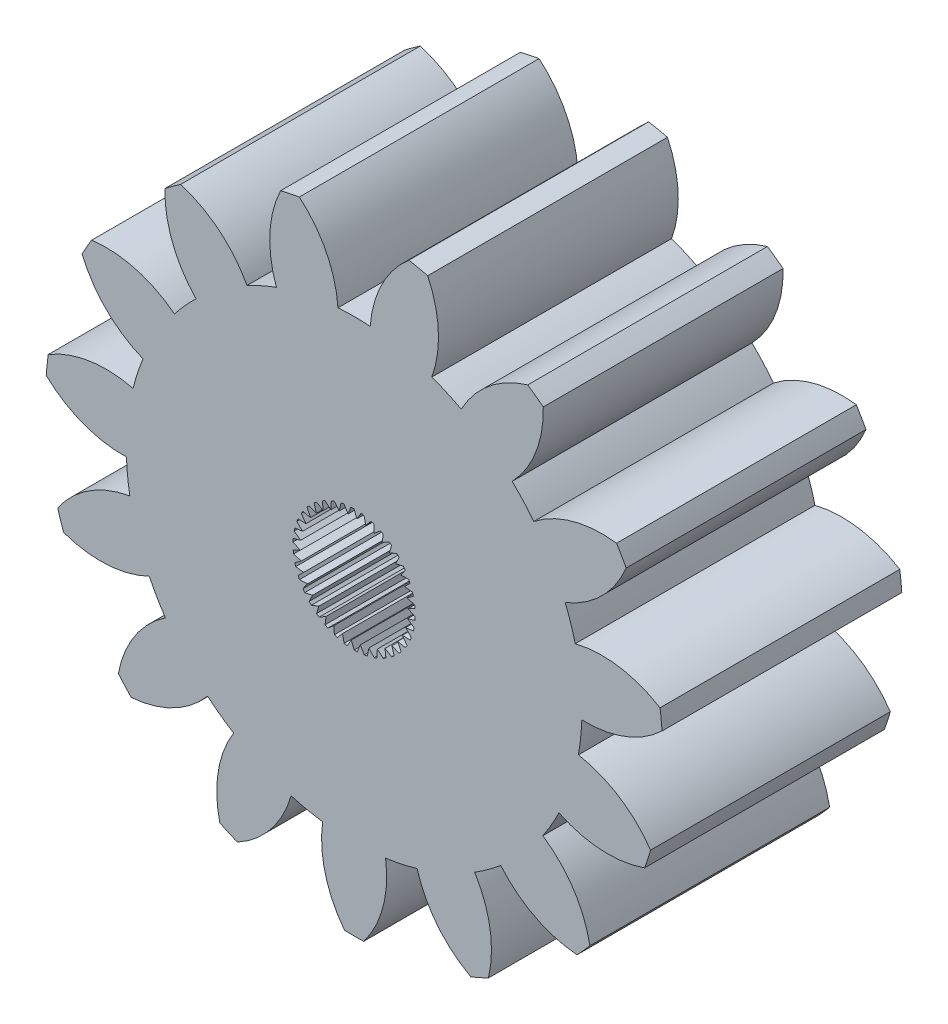
from build123d import *

# Parameters (mm, degrees)
SKETCH1_R           = 70.548036847
BOSS_EXTRUDE1_DEPTH = 10
SKETCH3_R           = 367.512428381
SKETCH3_R_2         = 2.249999999
CUT_EXTRUDE2_DEPTH  = 269.283414963
CUT_EXTRUDE4_DEPTH  = 10


with BuildPart() as part:
    # Sketch1 → Boss-Extrude1 (new body)
    with BuildSketch(Plane.XY):
        Circle(SKETCH1_R)
    extrude(amount=BOSS_EXTRUDE1_DEPTH)

    # Sketch3 → Cut-Extrude2 (cut, through all)
    # profile 1 of 2: a face of its own
    with BuildSketch(Plane(origin=(55.025604462, -141.718387499, 105.594585314), x_dir=(1, 0, 0), z_dir=(0, 0, 1))):
        with Locations((-43.461576529, 148.105383059)):
            Circle(SKETCH3_R)
        with BuildLine():
            ThreePointArc((-38.992966759, 156.489924055), (-37.834855129, 157.900828095), (-36.221197708, 158.75404699))
            ThreePointArc((-36.221197708, 158.75404699), (-35.892665836, 158.523094895), (-35.571495409, 158.28201064))
            ThreePointArc((-35.571495409, 158.28201064), (-35.884307233, 156.483672095), (-36.868280539, 154.946249158))
            ThreePointArc((-36.868280539, 154.946249158), (-36.400957543, 154.46279295), (-35.968998313, 153.947495063))
            ThreePointArc((-35.968998313, 153.947495063), (-34.337144321, 154.765373604), (-32.515959525, 154.888494247))
            ThreePointArc((-32.515959525, 154.888494247), (-32.309767405, 154.543883059), (-32.114421422, 154.193009851))
            ThreePointArc((-32.114421422, 154.193009851), (-33.131639425, 152.677377874), (-34.655870014, 151.673090132))
            ThreePointArc((-34.655870014, 151.673090132), (-34.425588568, 151.041353522), (-34.240564709, 150.394911831))
            ThreePointArc((-34.240564709, 150.394911831), (-32.417130735, 150.478346243), (-30.70331796, 149.850079957))
            ThreePointArc((-30.70331796, 149.850079957), (-30.655118083, 149.45139608), (-30.619373638, 149.051403086))
            ThreePointArc((-30.619373638, 149.051403086), (-32.165111587, 148.080544213), (-33.966046142, 147.783042142))
            ThreePointArc((-33.966046142, 147.783042142), (-34.012624001, 147.112258129), (-34.106527818, 146.446448275))
            ThreePointArc((-34.106527818, 146.446448275), (-32.406802162, 145.78101199), (-31.096695206, 144.509991723))
            ThreePointArc((-31.096695206, 144.509991723), (-31.214821769, 144.126171222), (-31.344859402, 143.746220863))
            ThreePointArc((-31.344859402, 143.746220863), (-33.151845162, 143.488005415), (-34.918085739, 143.948729825))
            ThreePointArc((-34.918085739, 143.948729825), (-35.233469168, 143.354883059), (-35.590063838, 142.784829614))
            ThreePointArc((-35.590063838, 142.784829614), (-34.307944507, 141.485582611), (-33.628072765, 139.791579314))
            ThreePointArc((-33.628072765, 139.791579314), (-33.892100612, 139.488988241), (-34.165435634, 139.194777386))
            ThreePointArc((-34.165435634, 139.194777386), (-35.921224952, 139.693853159), (-37.347372508, 140.833140613))
            ThreePointArc((-37.347372508, 140.833140613), (-37.877028847, 140.418912595), (-38.434655913, 140.04318298))
            ThreePointArc((-38.434655913, 140.04318298), (-37.791832987, 138.334776868), (-37.859752459, 136.510699101))
            ThreePointArc((-37.859752459, 136.510699101), (-38.224028776, 136.341658201), (-38.59339908, 136.184058581))
            ThreePointArc((-38.59339908, 136.184058581), (-39.994400032, 137.354130839), (-40.833860699, 138.974988187))
            ThreePointArc((-40.833860699, 138.974988187), (-41.486207555, 138.812002704), (-42.14844823, 138.695563981))
            ThreePointArc((-42.14844823, 138.695563981), (-42.256071633, 136.873397699), (-43.060038426, 135.234645079))
            ThreePointArc((-43.060038426, 135.234645079), (-43.461576529, 135.228383059), (-43.863114633, 135.234645079))
            ThreePointArc((-43.863114633, 135.234645079), (-44.667081426, 136.873397699), (-44.774704828, 138.695563981))
            ThreePointArc((-44.774704828, 138.695563981), (-45.436945504, 138.812002704), (-46.08929236, 138.974988187))
            ThreePointArc((-46.08929236, 138.974988187), (-46.928753027, 137.354130839), (-48.329753979, 136.184058581))
            ThreePointArc((-48.329753979, 136.184058581), (-48.699124282, 136.341658201), (-49.0634006, 136.510699101))
            ThreePointArc((-49.0634006, 136.510699101), (-49.131320072, 138.334776868), (-48.488497146, 140.04318298))
            ThreePointArc((-48.488497146, 140.04318298), (-49.046124211, 140.418912595), (-49.575780551, 140.833140613))
            ThreePointArc((-49.575780551, 140.833140613), (-51.001928107, 139.693853159), (-52.757717425, 139.194777386))
            ThreePointArc((-52.757717425, 139.194777386), (-53.031052447, 139.488988241), (-53.295080294, 139.791579314))
            ThreePointArc((-53.295080294, 139.791579314), (-52.615208552, 141.485582611), (-51.33308922, 142.784829614))
            ThreePointArc((-51.33308922, 142.784829614), (-51.689683891, 143.354883059), (-52.00506732, 143.948729825))
            ThreePointArc((-52.00506732, 143.948729825), (-53.771307897, 143.488005415), (-55.578293657, 143.746220863))
            ThreePointArc((-55.578293657, 143.746220863), (-55.70833129, 144.126171222), (-55.826457853, 144.509991723))
            ThreePointArc((-55.826457853, 144.509991723), (-54.516350896, 145.78101199), (-52.81662524, 146.446448275))
            ThreePointArc((-52.81662524, 146.446448275), (-52.910529057, 147.112258129), (-52.957106917, 147.783042142))
            ThreePointArc((-52.957106917, 147.783042142), (-54.758041472, 148.080544213), (-56.303779421, 149.051403086))
            ThreePointArc((-56.303779421, 149.051403086), (-56.268034976, 149.45139608), (-56.219835099, 149.850079957))
            ThreePointArc((-56.219835099, 149.850079957), (-54.506022324, 150.478346243), (-52.68258835, 150.394911831))
            ThreePointArc((-52.68258835, 150.394911831), (-52.497564491, 151.041353522), (-52.267283045, 151.673090132))
            ThreePointArc((-52.267283045, 151.673090132), (-53.791513634, 152.677377874), (-54.808731637, 154.193009851))
            ThreePointArc((-54.808731637, 154.193009851), (-54.613385654, 154.543883059), (-54.407193534, 154.888494247))
            ThreePointArc((-54.407193534, 154.888494247), (-52.586008737, 154.765373604), (-50.954154746, 153.947495063))
            ThreePointArc((-50.954154746, 153.947495063), (-50.522195516, 154.46279295), (-50.054872519, 154.946249158))
            ThreePointArc((-50.054872519, 154.946249158), (-51.038845826, 156.483672095), (-51.35165765, 158.28201064))
            ThreePointArc((-51.35165765, 158.28201064), (-51.030487223, 158.523094895), (-50.701955351, 158.75404699))
            ThreePointArc((-50.701955351, 158.75404699), (-49.088297929, 157.900828095), (-47.9301863, 156.489924055))
            ThreePointArc((-47.9301863, 156.489924055), (-47.325981375, 156.784978452), (-46.702421219, 157.036560288))
            ThreePointArc((-46.702421219, 157.036560288), (-46.975999319, 158.841284028), (-46.530316957, 160.611380068))
            ThreePointArc((-46.530316957, 160.611380068), (-46.138855372, 160.700989714), (-45.744789892, 160.778349))
            ThreePointArc((-45.744789892, 160.778349), (-44.617675874, 159.342561151), (-44.133554629, 157.582589738))
            ThreePointArc((-44.133554629, 157.582589738), (-43.461576529, 157.606383059), (-42.78959843, 157.582589738))
            ThreePointArc((-42.78959843, 157.582589738), (-42.305477184, 159.342561151), (-41.178363166, 160.778349))
            ThreePointArc((-41.178363166, 160.778349), (-40.784297687, 160.700989714), (-40.392836101, 160.611380068))
            ThreePointArc((-40.392836101, 160.611380068), (-39.94715374, 158.841284028), (-40.22073184, 157.036560288))
            ThreePointArc((-40.22073184, 157.036560288), (-39.597171684, 156.784978452), (-38.992966759, 156.489924055))
        make_face(mode=Mode.SUBTRACT)
    # profile 2 of 2: a face of its own
    with BuildSketch(Plane(origin=(55.025604462, -141.718387499, 105.594585314), x_dir=(1, 0, 0), z_dir=(0, 0, 1))):
        with Locations((-43.461576529, 148.105383059)):
            Circle(SKETCH3_R_2)
    extrude(amount=-CUT_EXTRUDE2_DEPTH, mode=Mode.SUBTRACT)

    # Sketch4 → Cut-Extrude4 (cut)
    with BuildSketch(Plane.XY.offset(10)):
        with BuildLine():
            Line((9.127956815, 5.633299661), (9.459541206, 5.590983238))
            Line((9.459541206, 5.590983238), (9.229545605, 5.360987637))
            ThreePointArc((9.229545605, 5.360987637), (9.256631551, 5.301444117), (9.285235917, 5.242614963))
            Line((9.285235918, 5.242614963), (9.619262985, 5.255452678))
            Line((9.619262985, 5.255452678), (9.430260255, 4.990737885))
            ThreePointArc((9.430260254, 4.990737885), (9.466777325, 4.936464662), (9.504674526, 4.883145985))
            Line((9.504674527, 4.883145986), (9.832032881, 4.950787659))
            Line((9.832032881, 4.950787659), (9.689178525, 4.658574404))
            ThreePointArc((9.689178524, 4.658574403), (9.734130628, 4.611051908), (9.780286927, 4.564698102))
            Line((9.780286928, 4.564698104), (10.092047088, 4.685298647))
            Line((10.092047088, 4.685298647), (9.9992378, 4.373557746))
            ThreePointArc((9.999237799, 4.373557744), (10.051398761, 4.334082267), (10.104555133, 4.295957744))
            Line((10.104555134, 4.295957747), (10.392213095, 4.466227491))
            Line((10.392213095, 4.466227491), (10.351980471, 4.143462423))
            ThreePointArc((10.35198047, 4.143462421), (10.409927473, 4.11311075), (10.468633953, 4.084255447))
            Line((10.468633954, 4.08425545), (10.724343156, 4.299549881))
            Line((10.724343156, 4.299549881), (10.737784636, 3.974564836))
            ThreePointArc((10.737784635, 3.974564833), (10.799937039, 3.954164883), (10.862592265, 3.935365897))
            Line((10.862592266, 3.935365901), (11.079377628, 4.189812348))
            Line((11.079377628, 4.189812348), (11.146126565, 3.87147207))
            ThreePointArc((11.146126565, 3.871472067), (11.210789012, 3.861580294), (11.275683913, 3.853350414))
            Line((11.275683914, 3.853350418), (11.447632098, 4.140008245))
            Line((11.447632098, 4.140008245), (11.565867754, 3.836996228))
            ThreePointArc((11.565867754, 3.836996224), (11.631276422, 3.837882452), (11.696640835, 3.840446166))
            Line((11.696640835, 3.84044617), (11.819061542, 4.151496099))
            Line((11.819061542, 4.151496099), (11.985558757, 3.87207772))
            ThreePointArc((11.985558758, 3.872077716), (12.049929468, 3.88371777), (12.113980423, 3.897005147))
            Line((12.113980422, 3.897005151), (12.183534335, 4.223962551))
            Line((12.183534335, 4.223962551), (12.393751498, 3.975759615))
            ThreePointArc((12.393751499, 3.975759611), (12.455328387, 3.99783598), (12.51631874, 4.021484576))
            Line((12.516318738, 4.02148458), (12.531108607, 4.355430905))
            Line((12.531108607, 4.355430905), (12.779311543, 4.145213741))
            ThreePointArc((12.779311545, 4.145213738), (12.836414954, 4.177124237), (12.892681046, 4.210488978))
            Line((12.892681044, 4.210488982), (12.85230344, 4.542315046))
            Line((12.85230344, 4.542315046), (13.131721819, 4.375817831))
            ThreePointArc((13.131721822, 4.375817829), (13.182794118, 4.416692022), (13.232801159, 4.458862806))
            Line((13.232801157, 4.458862809), (13.138357475, 4.779517264))
            Line((13.138357475, 4.779517264), (13.441369493, 4.661281607))
            ThreePointArc((13.441369495, 4.661281605), (13.485017562, 4.710004552), (13.527401488, 4.75983107))
            Line((13.527401486, 4.759831072), (13.381467904, 5.060567299))
            Line((13.381467904, 5.060567299), (13.699808183, 4.993818362))
            ThreePointArc((13.699808185, 4.99381836), (13.734841415, 5.049061025), (13.768446105, 5.105184139))
            Line((13.768446102, 5.105184141), (13.575003309, 5.377798839))
            Line((13.575003309, 5.377798839), (13.899988354, 5.364357358))
            ThreePointArc((13.899988357, 5.364357357), (13.925451135, 5.424612864), (13.94935994, 5.485501683))
            Line((13.949359937, 5.485501684), (13.713684547, 5.722558636))
            Line((13.713684547, 5.722558636), (14.036449615, 5.762791259))
            ThreePointArc((14.036449617, 5.762791259), (14.051647386, 5.826415995), (14.065208136, 5.890409629))
            Line((14.065208134, 5.89040963), (13.793728757, 6.085442539))
            Line((13.793728757, 6.085442539), (14.105469658, 6.178251827))
            ThreePointArc((14.105469659, 6.178251827), (14.109987863, 6.243510274), (14.112830656, 6.308863145))
            Line((14.112830654, 6.308863145), (13.81295254, 6.456552023))
            Line((13.81295254, 6.456552023), (14.105165795, 6.599406379))
            ThreePointArc((14.105165796, 6.599406379), (14.09888119, 6.664518459), (14.090928481, 6.72944791))
            Line((14.090928481, 6.729447909), (13.770831523, 6.825764189))
            Line((13.770831523, 6.825764189), (14.035546316, 7.014766918))
            ThreePointArc((14.035546315, 7.014766918), (14.018630327, 7.077956541), (14.000099047, 7.140691466))
            Line((14.000099047, 7.140691466), (13.668514656, 7.183007889))
            Line((13.668514656, 7.183007889), (13.898510257, 7.413003491))
            ThreePointArc((13.898510257, 7.41300349), (13.87142431, 7.47254701), (13.842819943, 7.531376164))
            Line((13.842819944, 7.531376164), (13.508792877, 7.518538449))
            Line((13.508792877, 7.518538449), (13.697795607, 7.783253242))
            ThreePointArc((13.697795606, 7.783253241), (13.661278535, 7.837526464), (13.623381334, 7.890845141))
            Line((13.623381335, 7.890845142), (13.296022981, 7.823203468))
            Line((13.296022981, 7.823203468), (13.438877336, 8.115416723))
            ThreePointArc((13.438877335, 8.115416722), (13.393925231, 8.162939217), (13.347768932, 8.209293022))
            Line((13.347768934, 8.209293023), (13.036008774, 8.08869248))
            Line((13.036008774, 8.08869248), (13.128818062, 8.400433381))
            ThreePointArc((13.12881806, 8.400433379), (13.076657098, 8.439908856), (13.023500726, 8.478033379))
            Line((13.023500728, 8.478033381), (12.735842767, 8.307763636))
            Line((12.735842767, 8.307763636), (12.776075391, 8.630528704))
            ThreePointArc((12.77607539, 8.630528701), (12.718128386, 8.660880372), (12.659421907, 8.689735675))
            Line((12.659421908, 8.689735677), (12.403712706, 8.474441246))
            Line((12.403712706, 8.474441246), (12.390271226, 8.799426292))
            ThreePointArc((12.390271224, 8.799426288), (12.328118821, 8.819826238), (12.265463595, 8.838625223))
            Line((12.265463596, 8.838625227), (12.048678234, 8.584178779))
            Line((12.048678234, 8.584178779), (11.981929297, 8.902519057))
            ThreePointArc((11.981929296, 8.902519053), (11.917266849, 8.912410825), (11.852371948, 8.920640705))
            Line((11.852371948, 8.920640709), (11.680423764, 8.633982882))
            Line((11.680423764, 8.633982882), (11.562188108, 8.9369949))
            ThreePointArc((11.562188108, 8.936994895), (11.496779441, 8.936108667), (11.431415027, 8.933544953))
            Line((11.431415027, 8.933544957), (11.30899432, 8.622495028))
            Line((11.30899432, 8.622495028), (11.142497105, 8.901913408))
            ThreePointArc((11.142497106, 8.901913403), (11.078126396, 8.890273349), (11.014075441, 8.876985972))
            Line((11.01407544, 8.876985976), (10.944521527, 8.550028576))
            Line((10.944521527, 8.550028576), (10.734304364, 8.798231512))
            ThreePointArc((10.734304365, 8.798231508), (10.672727478, 8.776155139), (10.611737125, 8.752506544))
            Line((10.611737124, 8.752506547), (10.596947255, 8.418560223))
            Line((10.596947255, 8.418560223), (10.348744319, 8.628777386))
            ThreePointArc((10.348744321, 8.628777382), (10.291640913, 8.596866884), (10.23537482, 8.563502142))
            Line((10.235374818, 8.563502146), (10.275752422, 8.231676081))
            Line((10.275752422, 8.231676081), (9.996334043, 8.398173296))
            ThreePointArc((9.996334045, 8.398173292), (9.945261749, 8.357299099), (9.895254708, 8.315128315))
            Line((9.895254705, 8.315128318), (9.989698387, 7.994473863))
            Line((9.989698387, 7.994473863), (9.686686369, 8.11270952))
            ThreePointArc((9.686686372, 8.112709517), (9.643038306, 8.063986571), (9.600654379, 8.014160053))
            Line((9.600654376, 8.014160055), (9.746587958, 7.713423828))
            Line((9.746587958, 7.713423828), (9.428247679, 7.780172766))
            ThreePointArc((9.428247683, 7.780172764), (9.393214452, 7.724930099), (9.359609763, 7.668806985))
            Line((9.35960976, 7.668806986), (9.553052553, 7.396192288))
            Line((9.553052553, 7.396192288), (9.228067508, 7.409633769))
            ThreePointArc((9.228067511, 7.409633768), (9.202604732, 7.349378261), (9.178695927, 7.288489443))
            Line((9.178695925, 7.288489444), (9.414371315, 7.051432492))
            Line((9.414371315, 7.051432492), (9.091606247, 7.011199868))
            ThreePointArc((9.091606249, 7.011199867), (9.07640848, 6.947575132), (9.06284773, 6.883581497))
            Line((9.062847728, 6.883581498), (9.334327105, 6.688548588))
            Line((9.334327105, 6.688548588), (9.022586204, 6.595739301))
            ThreePointArc((9.022586206, 6.595739301), (9.018068002, 6.530480853), (9.015225209, 6.465127982))
            Line((9.015225208, 6.465127982), (9.315103322, 6.317439104))
            Line((9.315103322, 6.317439104), (9.022890067, 6.174584748))
            ThreePointArc((9.022890068, 6.174584749), (9.029174674, 6.109472669), (9.037127382, 6.044543218))
            Line((9.037127381, 6.044543218), (9.357224339, 5.948226939))
            Line((9.357224339, 5.948226939), (9.092509546, 5.75922421))
            ThreePointArc((9.092509547, 5.75922421), (9.109425535, 5.696034586), (9.127956815, 5.633299661))
        make_face()
    extrude(amount=-CUT_EXTRUDE4_DEPTH, mode=Mode.SUBTRACT)


solid = part.part
